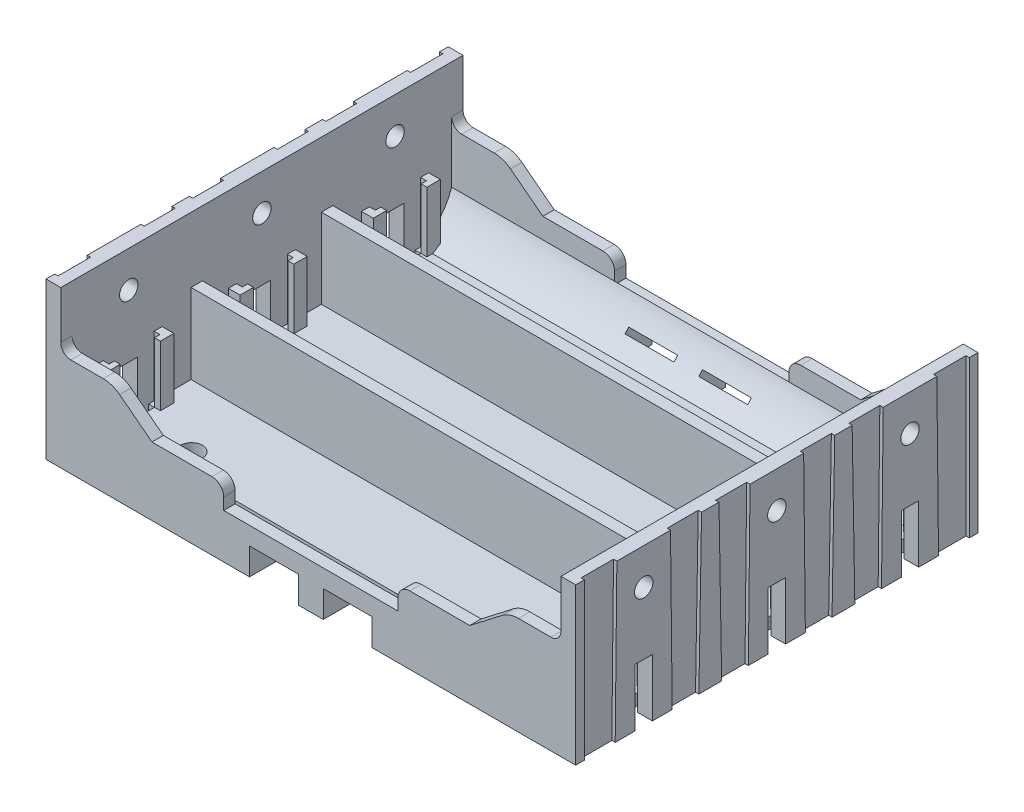
from build123d import *
from build123d.topology import SkipClean

# Parameters (mm, degrees)
SKETCH1_W               = 78
SKETCH1_H               = 60
SKETCH1_W_2             = 74.6
SKETCH1_H_2             = 56.6
EXTRUDE_THIN2_DEPTH     = 21.6
SKETCH5_W               = 78
SKETCH5_H               = 60
BOSS_EXTRUDE2_DEPTH     = 1.7
RIB1_REACH              = 56.442
SKETCH7_WALLS_W         = 185.483240216
SKETCH7_WALLS_H         = 1.7
CUT_EXTRUDE1_DEPTH      = 1.7
CUT_EXTRUDE2_START      = -60
CUT_EXTRUDE2_DEPTH      = 1.7
SKETCH11_W              = 74.6
SKETCH11_H              = 9.7
CUT_EXTRUDE3_DEPTH      = 1.7
CUT_EXTRUDE4_START      = -19.44
SKETCH11_2_W            = 74.6
SKETCH11_2_H            = 9.7
CUT_EXTRUDE4_DEPTH      = 1.7
SKETCH16_R              = 2.75
SKETCH16_R_2            = 1.65
BOSS_EXTRUDE5_DEPTH     = 0.5
SKETCH16_12_R           = 1.65
CUT_EXTRUDE8_DEPTH      = 55.441620108
SKETCH23_R              = 1.375
SKETCH23_W              = 1.3
SKETCH23_H              = 23.3
BOSS_EXTRUDE9_DEPTH     = 0.5
SKETCH27_W              = 10
SKETCH27_H              = 10.7
BOSS_EXTRUDE11_DEPTH    = 1.75
BOSS_EXTRUDE12_START    = 72.85
SKETCH27_2_W            = 10
SKETCH27_2_H            = 10.7
BOSS_EXTRUDE12_DEPTH    = 1.75
SKETCH31_W              = 0.875
SKETCH31_H              = 6
CUT_EXTRUDE11_DEPTH     = 9
SKETCH33_W              = 0.875
SKETCH33_H              = 6
CUT_EXTRUDE23_DEPTH     = 9
CUT_EXTRUDE24_DEPTH     = 9
CUT_EXTRUDE25_DEPTH     = 9
SKETCH36_W              = 0.875
SKETCH36_H              = 6
CUT_EXTRUDE26_DEPTH     = 9
SKETCH39_W              = 0.875
SKETCH39_H              = 6
SKETCH39_H_2            = 7.6
CUT_EXTRUDE27_DEPTH     = 9
SKETCH41_W              = 0.875
SKETCH41_H              = 6
CUT_EXTRUDE28_DEPTH     = 55.1
SKETCH42_W              = 0.875
SKETCH42_H              = 6
CUT_EXTRUDE29_DEPTH     = 55.1
SKETCH43_W              = 0.875
SKETCH43_H              = 6
CUT_EXTRUDE30_DEPTH     = 55.1
SKETCH23_10_W           = 2.6
SKETCH23_10_H           = 8.6
CUT_EXTRUDE31_DEPTH     = 2.2
CUT_EXTRUDE32_START     = -78
CUT_EXTRUDE32_OUTLINE_W = 2.6
CUT_EXTRUDE32_OUTLINE_H = 8.6
CUT_EXTRUDE32_DEPTH     = 1.7
BOSS_EXTRUDE14_START    = -78.5
SKETCH23_16_R           = 1.375
SKETCH23_16_W           = 1.3
SKETCH23_16_H           = 23.3
BOSS_EXTRUDE14_DEPTH    = 0.5
BOSS_EXTRUDE15_REACH    = 87.234
SKETCH23_17_R           = 1.375
CUT_EXTRUDE33_DEPTH     = 87.76871556
SKETCH49_W              = 7.3
SKETCH49_H              = 4
CUT_EXTRUDE34_DEPTH     = 4
CUT_EXTRUDE35_START     = -9.15
CUT_EXTRUDE35_DEPTH     = 7.3
CUT_EXTRUDE35_START_2   = 1.85
CUT_EXTRUDE35_2_DEPTH   = 7.3


# Read off the part's stored shape, not the designer's step: Cut-Extrude32, Cut-Extrude35
with BuildPart() as part:
    # Sketch1 → Extrude-Thin2 (new body)
    with BuildSketch(Plane(origin=(0, 0, 0), x_dir=(1, 0, 0), z_dir=(0, 1, 0))):
        Rectangle(SKETCH1_W, SKETCH1_H)
        Rectangle(SKETCH1_W_2, SKETCH1_H_2, mode=Mode.SUBTRACT)
    extrude(amount=EXTRUDE_THIN2_DEPTH)

    # Sketch5 → Boss-Extrude2 (add)
    with BuildSketch(Plane.XZ):
        Rectangle(SKETCH5_W, SKETCH5_H)
    extrude(amount=BOSS_EXTRUDE2_DEPTH)

    # Sketch7 walls → Rib1 (add, up to next)
    with BuildSketch(Plane(origin=(0, 21.6, 0), x_dir=(1, 0, 0), z_dir=(0, 1, 0)), mode=Mode.PRIVATE) as rib1_sk1:
        with Locations((0, -9.72)):
            Rectangle(SKETCH7_WALLS_W, SKETCH7_WALLS_H)
    rib1_tool1 = extrude(rib1_sk1.sketch, amount=-RIB1_REACH, mode=Mode.PRIVATE) - part.part
    # Sketch7 walls → Rib1 (add, up to next)
    with BuildSketch(Plane(origin=(0, 21.6, 0), x_dir=(1, 0, 0), z_dir=(0, 1, 0)), mode=Mode.PRIVATE) as rib1_sk2:
        with Locations((0, 9.72)):
            Rectangle(SKETCH7_WALLS_W, SKETCH7_WALLS_H)
    rib1_tool2 = extrude(rib1_sk2.sketch, amount=-RIB1_REACH, mode=Mode.PRIVATE) - part.part
    add(rib1_tool1.solids().sort_by_distance((0, 21.6, 9.72))[0])
    add(rib1_tool2.solids().sort_by_distance((0, 21.6, -9.72))[0])

    # Sketch9 → Cut-Extrude1 (cut)
    with BuildSketch(Plane.XY.offset(30)):
        with BuildLine():
            Line((-37.3, 14.5), (-37.3, 21.6))
            Line((-37.3, 21.6), (37.3, 21.6))
            Line((37.3, 21.6), (37.3, 14.5))
            ThreePointArc((37.3, 14.5), (36.860660172, 13.439339828), (35.8, 13))
            Line((35.8, 13), (30.96322735, 13))
            ThreePointArc((30.96322735, 13), (29.672878483, 12.786158977), (28.520494376, 12.1674999))
            Line((28.520494376, 12.1674999), (23.7, 8.45))
            Line((23.7, 8.45), (14.75, 8.45))
            ThreePointArc((14.75, 8.45), (13.512563133, 7.937436867), (13, 6.7))
            Line((13, 6.7), (13, 4.962129215))
            Line((13, 4.962129215), (-13, 4.962129215))
            Line((-13, 4.962129215), (-13, 6.7))
            ThreePointArc((-13, 6.7), (-13.512563133, 7.937436867), (-14.75, 8.45))
            Line((-14.75, 8.45), (-23.7, 8.45))
            Line((-23.7, 8.45), (-28.520494376, 12.1674999))
            ThreePointArc((-28.520494376, 12.1674999), (-29.672878483, 12.786158977), (-30.96322735, 13))
            Line((-30.96322735, 13), (-35.8, 13))
            ThreePointArc((-35.8, 13), (-36.860660172, 13.439339828), (-37.3, 14.5))
        make_face()
    extrude(amount=-CUT_EXTRUDE1_DEPTH, mode=Mode.SUBTRACT)

    # Sketch9<4> → Cut-Extrude2 (cut)
    with BuildSketch(Plane.XY.offset(30).offset(CUT_EXTRUDE2_START)):
        with BuildLine():
            Line((-37.3, 14.5), (-37.3, 21.6))
            Line((-37.3, 21.6), (37.3, 21.6))
            Line((37.3, 21.6), (37.3, 14.5))
            ThreePointArc((37.3, 14.5), (36.860660172, 13.439339828), (35.8, 13))
            Line((35.8, 13), (30.96322735, 13))
            ThreePointArc((30.96322735, 13), (29.672878483, 12.786158977), (28.520494376, 12.1674999))
            Line((28.520494376, 12.1674999), (23.7, 8.45))
            Line((23.7, 8.45), (14.75, 8.45))
            ThreePointArc((14.75, 8.45), (13.512563133, 7.937436867), (13, 6.7))
            Line((13, 6.7), (13, 4.962129215))
            Line((13, 4.962129215), (-13, 4.962129215))
            Line((-13, 4.962129215), (-13, 6.7))
            ThreePointArc((-13, 6.7), (-13.512563133, 7.937436867), (-14.75, 8.45))
            Line((-14.75, 8.45), (-23.7, 8.45))
            Line((-23.7, 8.45), (-28.520494376, 12.1674999))
            ThreePointArc((-28.520494376, 12.1674999), (-29.672878483, 12.786158977), (-30.96322735, 13))
            Line((-30.96322735, 13), (-35.8, 13))
            ThreePointArc((-35.8, 13), (-36.860660172, 13.439339828), (-37.3, 14.5))
        make_face()
    extrude(amount=CUT_EXTRUDE2_DEPTH, mode=Mode.SUBTRACT)

    # Sketch11 → Cut-Extrude3 (cut)
    with BuildSketch(Plane.XY.offset(10.57)):
        with Locations((0, 16.75)):
            Rectangle(SKETCH11_W, SKETCH11_H)
    extrude(amount=-CUT_EXTRUDE3_DEPTH, mode=Mode.SUBTRACT)

    # Sketch11<2> → Cut-Extrude4 (cut)
    with BuildSketch(Plane.XY.offset(10.57).offset(CUT_EXTRUDE4_START)):
        with Locations((0, 16.75)):
            Rectangle(SKETCH11_2_W, SKETCH11_2_H)
    extrude(amount=-CUT_EXTRUDE4_DEPTH, mode=Mode.SUBTRACT)

    # Sketch16 → Boss-Extrude5 (add)
    # profile 1 of 6: a face of its own
    with BuildSketch(Plane.XZ.offset(1.7)):
        with Locations(Location((-27.96, 19.86, 0), (0, 0, 270))):
            Circle(SKETCH16_R)
        with Locations(Location((-27.96, 19.86, 0), (0, 0, 270))):
            Circle(SKETCH16_R_2, mode=Mode.SUBTRACT)
    # profile 2 of 6: a face of its own
    with BuildSketch(Plane.XZ.offset(1.7)):
        with Locations(Location((-27.96, -19.86, 0), (0, 0, 270))):
            Circle(SKETCH16_R)
        with Locations(Location((-27.96, -19.86, 0), (0, 0, 270))):
            Circle(SKETCH16_R_2, mode=Mode.SUBTRACT)
    # profile 3 of 6: a face of its own
    with BuildSketch(Plane.XZ.offset(1.7)):
        with Locations(Location((-27.96, 0, 0), (0, 0, 270))):
            Circle(SKETCH16_R)
        with Locations(Location((-27.96, 0, 0), (0, 0, 270))):
            Circle(SKETCH16_R_2, mode=Mode.SUBTRACT)
    # profile 4 of 6: a face of its own
    with BuildSketch(Plane.XZ.offset(1.7)):
        with Locations(Location((27.96, 0, 0), (0, 0, 270))):
            Circle(SKETCH16_R)
        with Locations(Location((27.96, 0, 0), (0, 0, 270))):
            Circle(SKETCH16_R_2, mode=Mode.SUBTRACT)
    # profile 5 of 6: a face of its own
    with BuildSketch(Plane.XZ.offset(1.7)):
        with Locations(Location((27.96, -19.86, 0), (0, 0, 270))):
            Circle(SKETCH16_R)
        with Locations(Location((27.96, -19.86, 0), (0, 0, 270))):
            Circle(SKETCH16_R_2, mode=Mode.SUBTRACT)
    # profile 6 of 6: a face of its own
    with BuildSketch(Plane.XZ.offset(1.7)):
        with Locations(Location((27.96, 19.86, 0), (0, 0, 270))):
            Circle(SKETCH16_R)
        with Locations(Location((27.96, 19.86, 0), (0, 0, 270))):
            Circle(SKETCH16_R_2, mode=Mode.SUBTRACT)
    extrude(amount=BOSS_EXTRUDE5_DEPTH)

    # Sketch16<12> → Cut-Extrude8 (cut, through all)
    with BuildSketch(Plane.XZ.offset(1.7)):
        with Locations(Location((-27.96, 19.86, 0), (0, 0, 270))):
            Circle(SKETCH16_12_R)
        with Locations(Location((27.96, 19.86, 0), (0, 0, 270))):
            Circle(SKETCH16_12_R)
        with Locations(Location((27.96, 0, 0), (0, 0, 270))):
            Circle(SKETCH16_12_R)
        with Locations(Location((27.96, -19.86, 0), (0, 0, 270))):
            Circle(SKETCH16_12_R)
        with Locations(Location((-27.96, -19.86, 0), (0, 0, 270))):
            Circle(SKETCH16_12_R)
        with Locations(Location((-27.96, 0, 0), (0, 0, 270))):
            Circle(SKETCH16_12_R)
    extrude(amount=-CUT_EXTRUDE8_DEPTH, mode=Mode.SUBTRACT)

    # Sketch23 → Boss-Extrude9 (add)
    # profile 1 of 7: a face of its own
    with BuildSketch(Plane.ZY.offset(39)):
        Polygon((4.25, -1.7), (4, 21.6), (-4, 21.6), (-4.25, -1.7), (-1.3, -1.7), (-1.3, 6.9), (1.3, 6.9), (1.3, -1.7), align=None)
        with Locations((0, 16.2)):
            Circle(SKETCH23_R, mode=Mode.SUBTRACT)
    # profile 2 of 7: a face of its own
    with BuildSketch(Plane.ZY.offset(39)):
        Polygon((11.23, 21.6), (8.63, 21.6), (8.23, -1.7), (11.63, -1.7), align=None)
    # profile 3 of 7: a face of its own
    with BuildSketch(Plane.ZY.offset(39)):
        Polygon((-8.23, -1.7), (-8.63, 21.6), (-11.23, 21.6), (-11.63, -1.7), align=None)
    # profile 4 of 7: a face of its own
    with BuildSketch(Plane.ZY.offset(39)):
        Polygon((23.86, 21.6), (15.86, 21.6), (15.61, -1.7), (18.56, -1.7), (18.56, 6.9), (21.16, 6.9), (21.16, -1.7), (24.11, -1.7), align=None)
        with Locations(Location((19.86, 16.2, 0), (0, 0, 180))):
            Circle(SKETCH23_R, mode=Mode.SUBTRACT)
    # profile 5 of 7: a face of its own
    with BuildSketch(Plane.ZY.offset(39)):
        Polygon((-15.61, -1.7), (-15.86, 21.6), (-23.86, 21.6), (-24.11, -1.7), (-21.16, -1.7), (-21.16, 6.9), (-18.56, 6.9), (-18.56, -1.7), align=None)
        with Locations((-19.86, 16.2)):
            Circle(SKETCH23_R, mode=Mode.SUBTRACT)
    # profile 6 of 7: a face of its own
    with BuildSketch(Plane.ZY.offset(39)):
        with Locations((29.35, 9.95)):
            Rectangle(SKETCH23_W, SKETCH23_H)
    # profile 7 of 7: a face of its own
    with BuildSketch(Plane.ZY.offset(39)):
        with Locations((-29.35, 9.95)):
            Rectangle(SKETCH23_W, SKETCH23_H)
    extrude(amount=BOSS_EXTRUDE9_DEPTH)

    # Sketch27 → Boss-Extrude11 (add)
    with BuildSketch(Plane(origin=(-37.3, 0, 0), x_dir=(0, 0, -1), z_dir=(1, 0, 0))):
        with Locations((-19.883241422, 3.65)):
            Rectangle(SKETCH27_W, SKETCH27_H)
        with Locations((0, 3.65)):
            Rectangle(SKETCH27_W, SKETCH27_H)
        with Locations((19.86, 3.65)):
            Rectangle(SKETCH27_W, SKETCH27_H)
    extrude(amount=BOSS_EXTRUDE11_DEPTH)

    # Sketch27<2> → Boss-Extrude12 (add)
    with BuildSketch(Plane(origin=(-37.3, 0, 0), x_dir=(0, 0, -1), z_dir=(1, 0, 0)).offset(BOSS_EXTRUDE12_START)):
        with Locations((-19.883241422, 3.65)):
            Rectangle(SKETCH27_2_W, SKETCH27_2_H)
        with Locations((0, 3.65)):
            Rectangle(SKETCH27_2_W, SKETCH27_2_H)
        with Locations((19.86, 3.65)):
            Rectangle(SKETCH27_2_W, SKETCH27_2_H)
    extrude(amount=BOSS_EXTRUDE12_DEPTH)

    # Sketch31 → Cut-Extrude11 (cut)
    with BuildSketch(Plane(origin=(0, 9, 0), x_dir=(1, 0, 0), z_dir=(0, 1, 0))):
        Polygon((-37.3, -3.8), (-36.425, -3.8), (-36.425, -3), (-36.425, 3), (-36.425, 3.8), (-37.3, 3.8), align=None)
        with Locations((-35.9875, 0)):
            Rectangle(SKETCH31_W, SKETCH31_H)
    extrude(amount=-CUT_EXTRUDE11_DEPTH, mode=Mode.SUBTRACT)

    # Sketch33 → Cut-Extrude23 (cut)
    with BuildSketch(Plane(origin=(0, 9, 0), x_dir=(1, 0, 0), z_dir=(0, 1, 0))):
        Polygon((-37.3, 23.66), (-37.3, 16.06), (-36.425, 16.06), (-36.425, 16.86), (-36.425, 22.86), (-36.425, 23.66), align=None)
        with Locations((-35.9875, 19.86)):
            Rectangle(SKETCH33_W, SKETCH33_H)
    extrude(amount=-CUT_EXTRUDE23_DEPTH, mode=Mode.SUBTRACT)

    # Sketch34 → Cut-Extrude24 (cut)
    with BuildSketch(Plane(origin=(0, 9, 0), x_dir=(1, 0, 0), z_dir=(0, 1, 0))):
        Polygon((35.55, 16.86), (36.425, 16.86), (36.425, 16.06), (37.3, 16.06), (37.3, 23.66), (36.425, 23.66), (36.425, 22.86), (35.55, 22.86), align=None)
    extrude(amount=-CUT_EXTRUDE24_DEPTH, mode=Mode.SUBTRACT)

    # Sketch35 → Cut-Extrude25 (cut)
    with BuildSketch(Plane(origin=(0, 9, 0), x_dir=(1, 0, 0), z_dir=(0, 1, 0))):
        Polygon((35.55, 3), (35.55, -3), (36.425, -3), (36.425, -3.8), (37.3, -3.8), (37.3, 3.8), (36.425, 3.8), (36.425, 3), align=None)
    extrude(amount=-CUT_EXTRUDE25_DEPTH, mode=Mode.SUBTRACT)

    # Sketch36 → Cut-Extrude26 (cut)
    with BuildSketch(Plane(origin=(0, 9, 0), x_dir=(1, 0, 0), z_dir=(0, 1, 0))):
        Polygon((-37.3, -23.683241422), (-36.425, -23.683241422), (-36.425, -22.883241422), (-36.425, -16.883241422), (-36.425, -16.083241422), (-37.3, -16.083241422), align=None)
        with Locations((-35.9875, -19.883241422)):
            Rectangle(SKETCH36_W, SKETCH36_H)
    extrude(amount=-CUT_EXTRUDE26_DEPTH, mode=Mode.SUBTRACT)

    # Sketch39 → Cut-Extrude27 (cut)
    with BuildSketch(Plane(origin=(0, 9, 0), x_dir=(1, 0, 0), z_dir=(0, 1, 0))):
        with Locations((35.9875, -19.883241422)):
            Rectangle(SKETCH39_W, SKETCH39_H)
        with Locations((36.8625, -19.883241422)):
            Rectangle(SKETCH39_W, SKETCH39_H_2)
    extrude(amount=-CUT_EXTRUDE27_DEPTH, mode=Mode.SUBTRACT)

    # Sketch41 → Cut-Extrude28 (cut, through all)
    with BuildSketch(Plane(origin=(0, 0, 0), x_dir=(1, 0, 0), z_dir=(0, 1, 0))):
        with Locations((-36.8625, -19.883241422)):
            Rectangle(SKETCH41_W, SKETCH41_H)
        with Locations((36.8625, -19.883241422)):
            Rectangle(SKETCH41_W, SKETCH41_H)
    extrude(amount=-CUT_EXTRUDE28_DEPTH, mode=Mode.SUBTRACT)

    # Sketch42 → Cut-Extrude29 (cut, through all)
    with BuildSketch(Plane(origin=(0, 0, 0), x_dir=(1, 0, 0), z_dir=(0, 1, 0))):
        with Locations((36.8625, 0)):
            Rectangle(SKETCH42_W, SKETCH42_H)
        with Locations((-36.8625, 0)):
            Rectangle(SKETCH42_W, SKETCH42_H)
    extrude(amount=-CUT_EXTRUDE29_DEPTH, mode=Mode.SUBTRACT)

    # Sketch43 → Cut-Extrude30 (cut, through all)
    with BuildSketch(Plane(origin=(0, 0, 0), x_dir=(1, 0, 0), z_dir=(0, 1, 0))):
        with Locations((-36.8625, 19.86)):
            Rectangle(SKETCH43_W, SKETCH43_H)
        with Locations((36.8625, 19.86)):
            Rectangle(SKETCH43_W, SKETCH43_H)
    extrude(amount=-CUT_EXTRUDE30_DEPTH, mode=Mode.SUBTRACT)

    # Sketch23<10> → Cut-Extrude31 (cut)
    with BuildSketch(Plane.ZY.offset(39)):
        with Locations((-19.86, 2.6)):
            Rectangle(SKETCH23_10_W, SKETCH23_10_H)
        with Locations((0, 2.6)):
            Rectangle(SKETCH23_10_W, SKETCH23_10_H)
        with Locations((19.86, 2.6)):
            Rectangle(SKETCH23_10_W, SKETCH23_10_H)
    extrude(amount=-CUT_EXTRUDE31_DEPTH, mode=Mode.SUBTRACT)

    # Cut-Extrude32 outline → Cut-Extrude32 (cut)
    with BuildSketch(Plane.ZY.offset(39).offset(CUT_EXTRUDE32_START)):
        with Locations((19.86, 2.6)):
            Rectangle(CUT_EXTRUDE32_OUTLINE_W, CUT_EXTRUDE32_OUTLINE_H)
        with Locations((0, 2.6)):
            Rectangle(CUT_EXTRUDE32_OUTLINE_W, CUT_EXTRUDE32_OUTLINE_H)
        with Locations((-19.86, 2.6)):
            Rectangle(CUT_EXTRUDE32_OUTLINE_W, CUT_EXTRUDE32_OUTLINE_H)
    extrude(amount=CUT_EXTRUDE32_DEPTH, mode=Mode.SUBTRACT)

    # Sketch23<16> → Boss-Extrude14 (add)
    # profile 1 of 7: a face of its own
    with BuildSketch(Plane.ZY.offset(39).offset(BOSS_EXTRUDE14_START)):
        Polygon((4.25, -1.7), (4, 21.6), (-4, 21.6), (-4.25, -1.7), (-1.3, -1.7), (-1.3, 6.9), (1.3, 6.9), (1.3, -1.7), align=None)
        with Locations((0, 16.2)):
            Circle(SKETCH23_16_R, mode=Mode.SUBTRACT)
    # profile 2 of 7: a face of its own
    with BuildSketch(Plane.ZY.offset(39).offset(BOSS_EXTRUDE14_START)):
        Polygon((11.23, 21.6), (8.63, 21.6), (8.23, -1.7), (11.63, -1.7), align=None)
    # profile 3 of 7: a face of its own
    with BuildSketch(Plane.ZY.offset(39).offset(BOSS_EXTRUDE14_START)):
        Polygon((-8.23, -1.7), (-8.63, 21.6), (-11.23, 21.6), (-11.63, -1.7), align=None)
    # profile 4 of 7: a face of its own
    with BuildSketch(Plane.ZY.offset(39).offset(BOSS_EXTRUDE14_START)):
        Polygon((23.86, 21.6), (15.86, 21.6), (15.61, -1.7), (18.56, -1.7), (18.56, 6.9), (21.16, 6.9), (21.16, -1.7), (24.11, -1.7), align=None)
        with Locations(Location((19.86, 16.2, 0), (0, 0, 180))):
            Circle(SKETCH23_16_R, mode=Mode.SUBTRACT)
    # profile 5 of 7: a face of its own
    with BuildSketch(Plane.ZY.offset(39).offset(BOSS_EXTRUDE14_START)):
        Polygon((-15.61, -1.7), (-15.86, 21.6), (-23.86, 21.6), (-24.11, -1.7), (-21.16, -1.7), (-21.16, 6.9), (-18.56, 6.9), (-18.56, -1.7), align=None)
        with Locations((-19.86, 16.2)):
            Circle(SKETCH23_16_R, mode=Mode.SUBTRACT)
    # profile 6 of 7: a face of its own
    with BuildSketch(Plane.ZY.offset(39).offset(BOSS_EXTRUDE14_START)):
        with Locations((29.35, 9.95)):
            Rectangle(SKETCH23_16_W, SKETCH23_16_H)
    # profile 7 of 7: a face of its own
    with BuildSketch(Plane.ZY.offset(39).offset(BOSS_EXTRUDE14_START)):
        with Locations((-29.35, 9.95)):
            Rectangle(SKETCH23_16_W, SKETCH23_16_H)
    extrude(amount=BOSS_EXTRUDE14_DEPTH)

    # Sketch15 → Boss-Extrude15 (add, up to next)
    with BuildSketch(Plane(origin=(-37.3, 0, 0), x_dir=(0, 0, -1), z_dir=(1, 0, 0)), mode=Mode.PRIVATE) as boss_extrude15_sk1:
        with BuildLine():
            Line((-28.3, 5.410164343), (-28.3, 0))
            Line((-28.3, 0), (-23.68696566, 0))
            ThreePointArc((-23.68696566, 0), (-26.518686052, 2.257262042), (-28.3, 5.410164343))
        make_face()
    boss_extrude15_tool1 = extrude(boss_extrude15_sk1.sketch, amount=BOSS_EXTRUDE15_REACH, mode=Mode.PRIVATE) - part.part
    # Sketch15 → Boss-Extrude15 (add, up to next)
    with BuildSketch(Plane(origin=(-37.3, 0, 0), x_dir=(0, 0, -1), z_dir=(1, 0, 0)), mode=Mode.PRIVATE) as boss_extrude15_sk2:
        with BuildLine():
            Line((28.3, 5.410164343), (28.3, 0))
            Line((28.3, 0), (23.68696566, 0))
            ThreePointArc((23.68696566, 0), (26.518686052, 2.257262042), (28.3, 5.410164343))
        make_face()
    boss_extrude15_tool2 = extrude(boss_extrude15_sk2.sketch, amount=BOSS_EXTRUDE15_REACH, mode=Mode.PRIVATE) - part.part
    add(boss_extrude15_tool1.solids().sort_by_distance((-37.3, 1.544233, 26.962644))[0])
    add(boss_extrude15_tool2.solids().sort_by_distance((-37.3, 1.544233, -26.962644))[0])

    # Sketch23<17> → Cut-Extrude33 (cut, through all)
    with BuildSketch(Plane.ZY.offset(39)):
        with Locations(Location((-19.86, 16.2, 0), (0, 0, 180))):
            Circle(SKETCH23_17_R)
        with Locations(Location((0, 16.2, 0), (0, 0, 180))):
            Circle(SKETCH23_17_R)
        with Locations(Location((19.86, 16.2, 0), (0, 0, 180))):
            Circle(SKETCH23_17_R)
    extrude(amount=-CUT_EXTRUDE33_DEPTH, mode=Mode.SUBTRACT)

    # Sketch49 → Cut-Extrude34 (cut)
    with SkipClean():  # the faces are left unmerged after this step: merging them gives an invalid solid
        with BuildSketch(Plane.XY.offset(30)):
            with Locations((-5.5, 0.3)):
                Rectangle(SKETCH49_W, SKETCH49_H)
            with Locations((5.5, 0.3)):
                Rectangle(SKETCH49_W, SKETCH49_H)
        extrude(amount=-CUT_EXTRUDE34_DEPTH, mode=Mode.SUBTRACT)

    # Cut-Extrude35 outline → Cut-Extrude35 (cut)
    with SkipClean():  # the faces are left unmerged after this step: merging them gives an invalid solid
        with BuildSketch(Plane.YZ.offset(CUT_EXTRUDE35_START)):
            with BuildLine():
                Line((2.3, -30), (2.3, -26.554909934))
                ThreePointArc((2.3, -26.554909934), (1.992158868, -26.283971546), (1.696297526, -26))
                Line((1.696297526, -26), (-1.7, -26))
                Line((-1.7, -26), (-1.7, -30))
                Line((-1.7, -30), (2.3, -30))
            make_face()
        extrude(amount=CUT_EXTRUDE35_DEPTH, mode=Mode.SUBTRACT)

    # Cut-Extrude35 2 outline → Cut-Extrude35 2 (cut)
    with SkipClean():  # the faces are left unmerged after this step: merging them gives an invalid solid
        with BuildSketch(Plane.YZ.offset(CUT_EXTRUDE35_START_2)):
            with BuildLine():
                Line((2.3, -30), (2.3, -26.554909934))
                ThreePointArc((2.3, -26.554909934), (1.992158868, -26.283971546), (1.696297526, -26))
                Line((1.696297526, -26), (-1.7, -26))
                Line((-1.7, -26), (-1.7, -30))
                Line((-1.7, -30), (2.3, -30))
            make_face()
        extrude(amount=CUT_EXTRUDE35_2_DEPTH, mode=Mode.SUBTRACT)


solid = part.part
